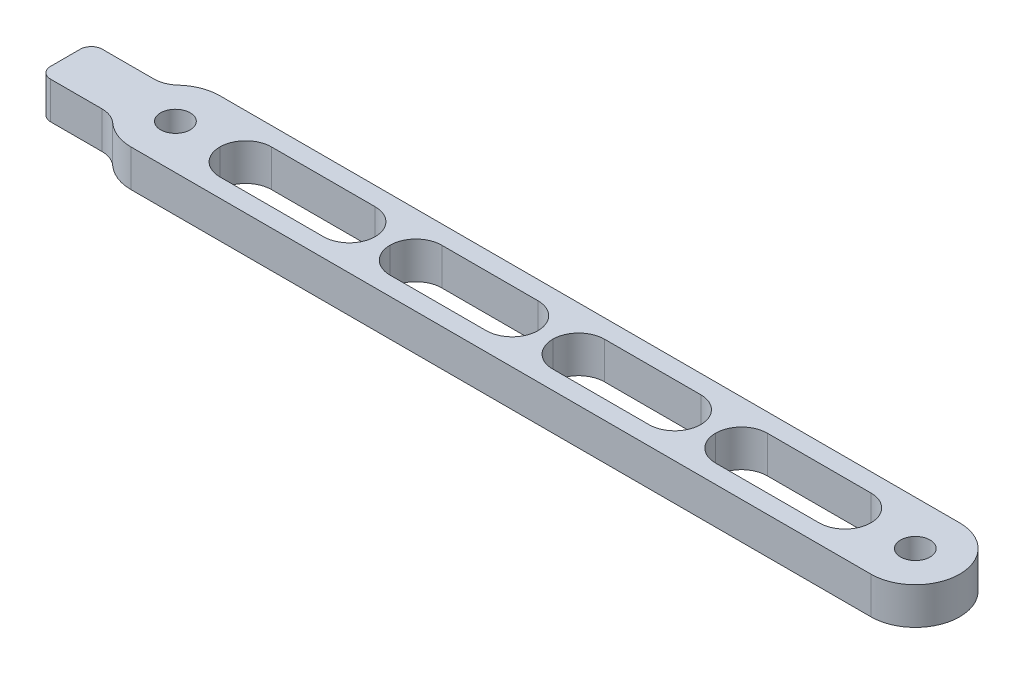
from build123d import *

# Parameters (mm, degrees)
SKETCH1_R           = 4
SKETCH1_W           = 42
SKETCH1_H           = 14
SKETCH1_W_2         = 40
BOSS_EXTRUDE1_DEPTH = 10
FILLET1_R           = 7
FILLET2_R           = 3


with BuildPart() as part:
    # Sketch1 → Boss-Extrude1 (new body)
    with BuildSketch(Plane(origin=(0, 0, 0), x_dir=(1, 0, 0), z_dir=(0, 1, 0))):
        with BuildLine():
            Line((-200, 12), (0, 12))
            ThreePointArc((0, 12), (12, 0), (0, -12))
            Line((0, -12), (-200, -12))
            ThreePointArc((-200, -12), (-205.477225575, -10.677078252), (-209.746794345, -7))
            Line((-209.746794345, -7), (-229.746794345, -7))
            Line((-229.746794345, -7), (-229.746794345, 7))
            Line((-229.746794345, 7), (-209.746794345, 7))
            ThreePointArc((-209.746794345, 7), (-205.477225575, 10.677078252), (-200, 12))
        make_face()
        with Locations(Location((-200, 0, 0), (0, 0, 270))):
            Circle(SKETCH1_R, mode=Mode.SUBTRACT)
        with Locations(Location((0, 0, 0), (0, 0, 270))):
            Circle(SKETCH1_R, mode=Mode.SUBTRACT)
        with Locations((-167, 0)):
            Rectangle(SKETCH1_W, SKETCH1_H, mode=Mode.SUBTRACT)
        with Locations((-122, 0)):
            Rectangle(SKETCH1_W_2, SKETCH1_H, mode=Mode.SUBTRACT)
        with Locations((-78, 0)):
            Rectangle(SKETCH1_W_2, SKETCH1_H, mode=Mode.SUBTRACT)
        with Locations((-33, 0)):
            Rectangle(SKETCH1_W, SKETCH1_H, mode=Mode.SUBTRACT)
    extrude(amount=BOSS_EXTRUDE1_DEPTH)

    # Fillet1
    fillet1_edges = [part.edges().sort_by_distance(p)[0] for p in [
        (-142, 5, -7),
        (-98, 5, -7),
        (-54, 5, -7),
        (-58, 5, -7),
        (-12, 5, -7),
        (-102, 5, -7),
        (-146, 5, -7),
        (-146, 5, 7),
        (-102, 5, 7),
        (-58, 5, 7),
        (-12, 5, 7),
        (-54, 5, 7),
        (-98, 5, 7),
        (-142, 5, 7),
        (-188, 5, 7),
        (-188, 5, -7),
        (-209.746794345, 5, 7),
        (-209.746794345, 5, -7),
    ]]
    fillet(fillet1_edges, radius=FILLET1_R - 0.0001)  # a hair under: the kernel refuses the full size

    # Fillet2
    fillet2_edges = [part.edges().sort_by_distance(p)[0] for p in [
        (-229.746794345, 5, 7),
        (-229.746794345, 5, -7),
    ]]
    fillet(fillet2_edges, radius=FILLET2_R)


solid = part.part
